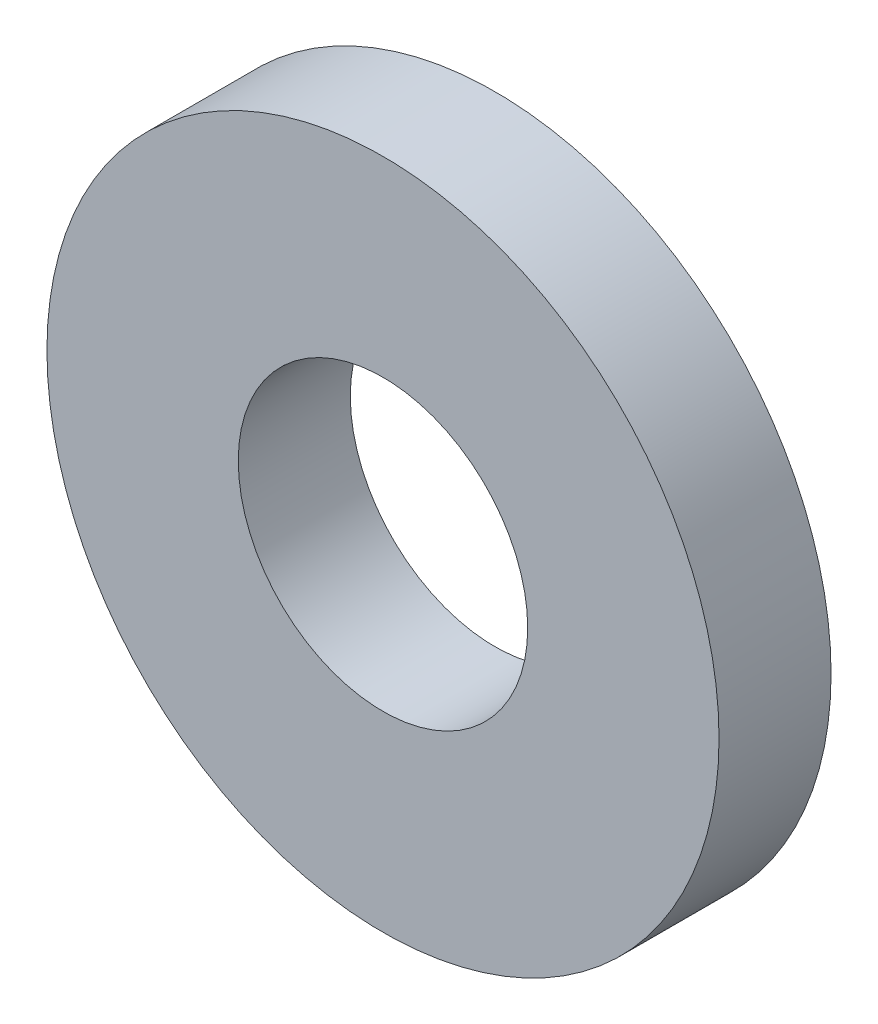
from build123d import *

# Parameters (mm, degrees)
SKETCH1_R                = 9.525
BOSS_EXTRUDE1_DEPTH      = 1.5875
F_5_16_CLEARANCE_HOLE1_D = 8.2042


with BuildPart() as part:
    # Sketch1 → Boss-Extrude1 (new, symmetric)
    with BuildSketch(Plane.XY):
        Circle(SKETCH1_R)
    extrude(amount=BOSS_EXTRUDE1_DEPTH, both=True)

    # 5/16 Clearance Hole1 (through all)
    with Locations(Plane.XY.offset(1.5875)):
        with Locations((0, 0)):
            Hole(F_5_16_CLEARANCE_HOLE1_D / 2)


solid = part.part
